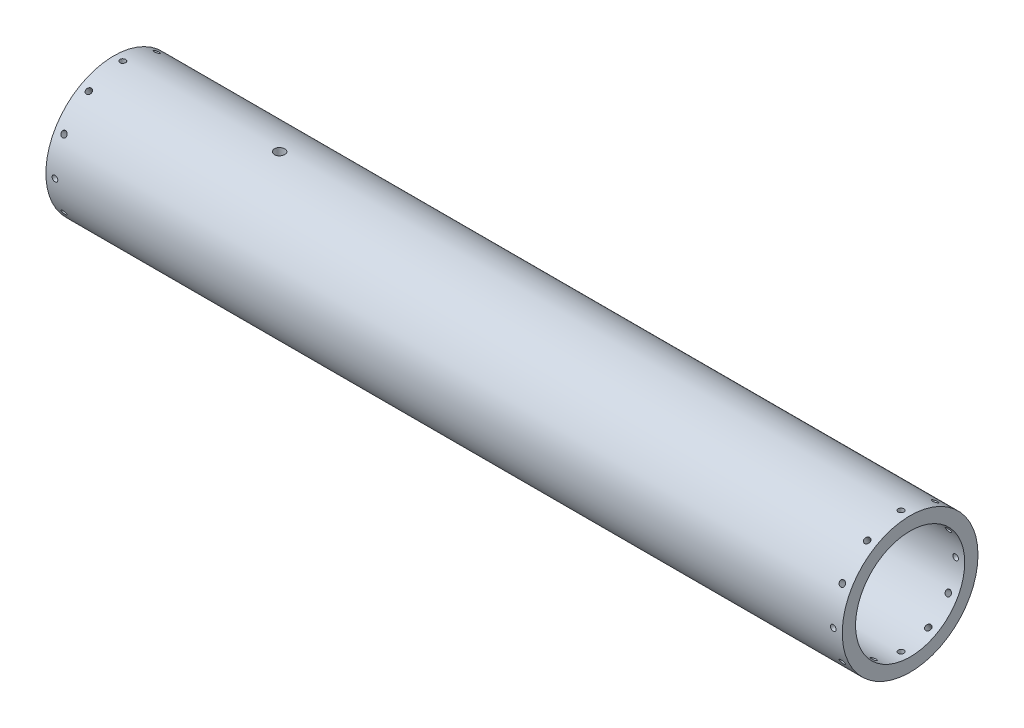
from build123d import *

# Parameters (mm, degrees)
SKETCH1_R           = 57.15
SKETCH1_R_2         = 45.9486
BOSS_EXTRUDE1_DEPTH = 670.56
SKETCH6_R           = 2.413
CUT_EXTRUDE1_DEPTH  = 15.24
SKETCH7_R           = 2.413
CUT_EXTRUDE2_DEPTH  = 15.24
CIRPATTERN2_COUNT   = 12
CIRPATTERN3_COUNT   = 12
SKETCH8_R           = 4.3053
CUT_EXTRUDE3_DEPTH  = 683.628248953


with BuildPart() as part:
    # Sketch1 → Boss-Extrude1 (new body)
    with BuildSketch(Plane(origin=(0, 0, 0), x_dir=(0, 0, -1), z_dir=(1, 0, 0))):
        Circle(SKETCH1_R)
        Circle(SKETCH1_R_2, mode=Mode.SUBTRACT)
    extrude(amount=BOSS_EXTRUDE1_DEPTH)

    # Sketch6 → Cut-Extrude1 (cut)
    with BuildSketch(Plane(origin=(0, 57.15, 0), x_dir=(1, 0, 0), z_dir=(0, 1, 0))):
        with Locations((7.62, 0)):
            Circle(SKETCH6_R)
    cut_extrude1 = extrude(amount=-CUT_EXTRUDE1_DEPTH, mode=Mode.SUBTRACT)

    # Sketch7 → Cut-Extrude2 (cut)
    with BuildSketch(Plane(origin=(0, 57.15, 0), x_dir=(1, 0, 0), z_dir=(0, 1, 0))):
        with Locations((662.94, 0)):
            Circle(SKETCH7_R)
    cut_extrude2 = extrude(amount=-CUT_EXTRUDE2_DEPTH, mode=Mode.SUBTRACT)

    # CirPattern2: Cut-Extrude2 ×12 about axis
    cirpattern2_axis = Axis((670.56, 0, 0), (1, 0, 0))
    for i in range(1, CIRPATTERN2_COUNT):
        add(cut_extrude2.rotate(cirpattern2_axis, i * 360 / CIRPATTERN2_COUNT), mode=Mode.SUBTRACT)

    # CirPattern3: Cut-Extrude1 ×12 about axis
    cirpattern3_axis = Axis((0, 0, 0), (-1, 0, 0))
    for i in range(1, CIRPATTERN3_COUNT):
        add(cut_extrude1.rotate(cirpattern3_axis, i * 360 / CIRPATTERN3_COUNT), mode=Mode.SUBTRACT)

    # Sketch8 → Cut-Extrude3 (cut, through all)
    with BuildSketch(Plane(origin=(0, 57.15, 0), x_dir=(1, 0, 0), z_dir=(0, 1, 0))):
        with Locations((139.7, 0)):
            Circle(SKETCH8_R)
    extrude(amount=-CUT_EXTRUDE3_DEPTH, mode=Mode.SUBTRACT)


solid = part.part
